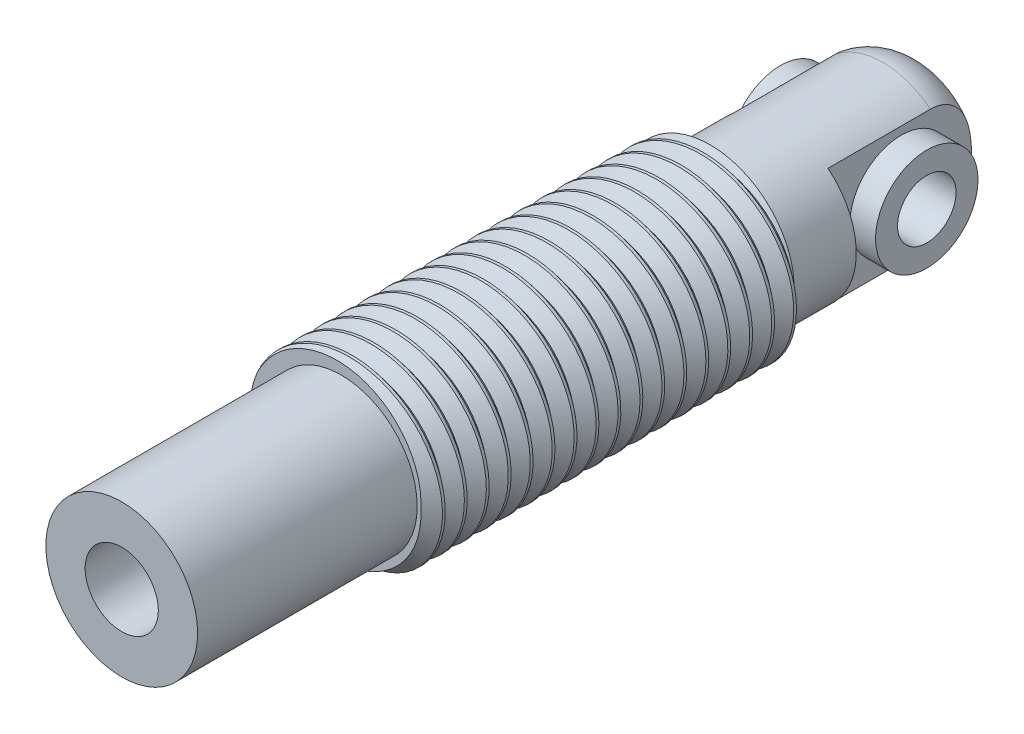
from build123d import *

# Parameters (mm, degrees)
SCHIZZO1_R                   = 10.37
ESTRUSIONE_ESTRUSIONE1_DEPTH = 110
RACCORDO1_R                  = 6
SCHIZZO2_W                   = 5
SCHIZZO2_H                   = 18
TAGLIO_ESTRUSIONE1_DEPTH     = 20
SCHIZZO3_R                   = 7
ESTRUSIONE_ESTRUSIONE2_DEPTH = 3.5
SCHIZZO4_R                   = 4
TAGLIO_ESTRUSIONE2_DEPTH     = 20
SCHIZZO5_R                   = 12.5
ESTRUSIONE_ESTRUSIONE3_DEPTH = 51
TAGLIA_SWEEP2_PITCH          = 3
SCHIZZO10_R                  = 5
TAGLIO_ESTRUSIONE3_DEPTH     = 60


with BuildPart() as part:
    # Schizzo1 → Estrusione-Estrusione1 (new body)
    with BuildSketch(Plane.XY):
        Circle(SCHIZZO1_R)
    extrude(amount=ESTRUSIONE_ESTRUSIONE1_DEPTH)

    # Raccordo1
    raccordo1_edges = [part.edges().sort_by_distance(p)[0] for p in [
        (-10.37, 0, 0),
    ]]
    fillet(raccordo1_edges, radius=RACCORDO1_R)

    # Schizzo2 → Taglio-Estrusione1 (cut)
    with BuildSketch(Plane(origin=(0, 0, 0), x_dir=(-1, 0, 0), z_dir=(0, 0, -1))):
        with Locations((9, 0)):
            Rectangle(SCHIZZO2_W, SCHIZZO2_H)
    taglio_estrusione1 = extrude(amount=-TAGLIO_ESTRUSIONE1_DEPTH, mode=Mode.SUBTRACT)

    # Specchia1: Taglio-Estrusione1 across plane
    add(taglio_estrusione1.mirror(Plane(origin=(0, 0, 0), x_dir=(0, 0, 1), z_dir=(1, 0, 0))), mode=Mode.SUBTRACT)

    # Schizzo3 → Estrusione-Estrusione2 (add)
    with BuildSketch(Plane(origin=(6.5, 0, 0), x_dir=(0, 0, -1), z_dir=(1, 0, 0))):
        with Locations((-10, 0)):
            Circle(SCHIZZO3_R)
    estrusione_estrusione2 = extrude(amount=ESTRUSIONE_ESTRUSIONE2_DEPTH)

    # Specchia2: Estrusione-Estrusione2 across plane
    add(estrusione_estrusione2.mirror(Plane(origin=(0, 0, 0), x_dir=(0, 0, 1), z_dir=(1, 0, 0))))

    # Schizzo4 → Taglio-Estrusione2 (cut)
    with BuildSketch(Plane(origin=(10, 0, 0), x_dir=(0, 0, -1), z_dir=(1, 0, 0))):
        with Locations((-10, 0)):
            Circle(SCHIZZO4_R)
    extrude(amount=-TAGLIO_ESTRUSIONE2_DEPTH, mode=Mode.SUBTRACT)

    # Schizzo5 → Estrusione-Estrusione3 (add)
    with BuildSketch(Plane.XY.offset(80)):
        Circle(SCHIZZO5_R)
    extrude(amount=-ESTRUSIONE_ESTRUSIONE3_DEPTH)

    # Taglia-Sweep2: arcs per turn and ends read off the stored shape
    # Taglia-Sweep2: the profile of Schizzo9 profile screwed along a right-hand helix through 18.6 turns, 10 arcs to a turn; built about Z, then put on its axis
    taglia_sweep2_z = Axis((0, 0, 0), (0, 0, 1))
    taglia_sweep2_corners = [(12.5003, 0, -4.310241104), (12.5003, 0, -1.689758896), (10.87, 0, -3)]
    with BuildLine(mode=Mode.PRIVATE) as taglia_sweep2_profile:
        Line(taglia_sweep2_corners[0], taglia_sweep2_corners[1])
        Line(taglia_sweep2_corners[1], taglia_sweep2_corners[2])
        Line(taglia_sweep2_corners[2], taglia_sweep2_corners[0])
    taglia_sweep2_cap = Face(taglia_sweep2_profile.wire())
    taglia_sweep2_turn_angles = [0, 18, 36, 54, 72, 90, 108, 126, 144, 162, 180, 198, 216, 234, 252, 270, 288, 306, 324, 342, 360]
    taglia_sweep2_turn_weights = [1, 0.9510565162951535, 1, 0.9510565162951535, 1, 0.9510565162951535, 1, 0.9510565162951535, 1, 0.9510565162951535, 1, 0.9510565162951535, 1, 0.9510565162951535, 1, 0.9510565162951535, 1, 0.9510565162951535, 1, 0.9510565162951535, 1]
    taglia_sweep2_turn_rails = [Edge.make_bspline([Vector(p[0], p[1], 0).rotate(taglia_sweep2_z, taglia_sweep2_turn_angles[k]) / taglia_sweep2_turn_weights[k] + Vector(0, 0, p[2] + TAGLIA_SWEEP2_PITCH * taglia_sweep2_turn_angles[k] / 360) for k in range(21)], [0, 0, 0, 1, 1, 2, 2, 3, 3, 4, 4, 5, 5, 6, 6, 7, 7, 8, 8, 9, 9, 10, 10, 10], 2, taglia_sweep2_turn_weights) for p in taglia_sweep2_corners]
    taglia_sweep2_turn_sides = [Face.make_surface_from_curves(taglia_sweep2_turn_rails[p[0]], taglia_sweep2_turn_rails[p[1]]) for p in [(0, 1), (1, 2), (2, 0)]]
    taglia_sweep2_last_angles = [6480, 6498, 6516, 6534, 6552, 6570, 6588, 6606, 6624, 6642, 6660, 6678, 6696]
    taglia_sweep2_last_weights = [1, 0.9510565162951535, 1, 0.9510565162951535, 1, 0.9510565162951535, 1, 0.9510565162951535, 1, 0.9510565162951535, 1, 0.9510565162951535, 1]
    taglia_sweep2_last_rails = [Edge.make_bspline([Vector(p[0], p[1], 0).rotate(taglia_sweep2_z, taglia_sweep2_last_angles[k]) / taglia_sweep2_last_weights[k] + Vector(0, 0, p[2] + TAGLIA_SWEEP2_PITCH * taglia_sweep2_last_angles[k] / 360) for k in range(13)], [0, 0, 0, 1, 1, 2, 2, 3, 3, 4, 4, 5, 5, 6, 6, 6], 2, taglia_sweep2_last_weights) for p in taglia_sweep2_corners]
    taglia_sweep2_last_sides = [Face.make_surface_from_curves(taglia_sweep2_last_rails[p[0]], taglia_sweep2_last_rails[p[1]]) for p in [(0, 1), (1, 2), (2, 0)]]
    taglia_sweep2 = Plane(origin=(0, 0, 29), x_dir=(1, 0, 0), z_dir=(0, 0, 1)) * Solid(Shell([*[p.moved(Location((0, 0, TAGLIA_SWEEP2_PITCH * i))) for i in range(18) for p in taglia_sweep2_turn_sides], *taglia_sweep2_last_sides, taglia_sweep2_cap, taglia_sweep2_cap.rotate(taglia_sweep2_z, 6696).moved(Location((0, 0, TAGLIA_SWEEP2_PITCH * 6696 / 360)))]))
    add(taglia_sweep2, mode=Mode.SUBTRACT)

    # Schizzo10 → Taglio-Estrusione3 (cut)
    with BuildSketch(Plane.XY.offset(110)):
        Circle(SCHIZZO10_R)
    extrude(amount=-TAGLIO_ESTRUSIONE3_DEPTH, mode=Mode.SUBTRACT)


solid = part.part
